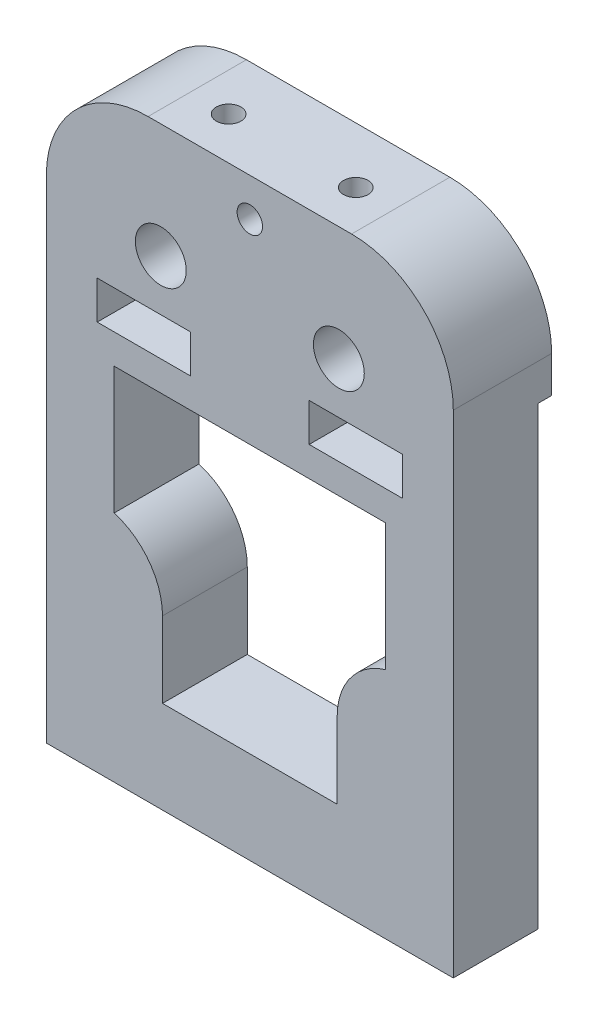
from build123d import *

# Parameters (mm, degrees)
SKETCH1_W               = 48
SKETCH1_H               = 70
BOSS_EXTRUDE1_DEPTH     = 10
SKETCH2_R               = 3
CUT_EXTRUDE1_DEPTH      = 86.463442477
SKETCH3_W               = 20.6
SKETCH3_H               = 20.6
CUT_EXTRUDE2_DEPTH      = 86.463442477
FILLET1_R               = 12
SKETCH4_R               = 1.5
CUT_EXTRUDE3_DEPTH      = 86.463442477
SKETCH5_R               = 1.45
CUT_EXTRUDE4_DEPTH      = 10
CUT_EXTRUDE5_DEPTH      = 86.463442477
CUT_EXTRUDE5_DEPTH_BACK = 86.463442477
SKETCH7_W               = 11
SKETCH7_H               = 4.5
SKETCH11_W              = 32
SKETCH11_H              = 15
CUT_EXTRUDE6_DEPTH      = 86.463442477
CUT_EXTRUDE7_DEPTH      = 8
CUT_EXTRUDE7_DEPTH_BACK = 5
SKETCH12_R              = 1.5
SKETCH13_R              = 1.5
BOSS_EXTRUDE4_DEPTH     = 1.6
FILLET2_R               = 8


with BuildPart() as part:
    # Sketch1 → Boss-Extrude1 (new body)
    with BuildSketch(Plane.XY):
        with Locations((24, -35)):
            Rectangle(SKETCH1_W, SKETCH1_H)
    extrude(amount=BOSS_EXTRUDE1_DEPTH)

    # Sketch2 → Cut-Extrude1 (cut, through all)
    with BuildSketch(Plane.XY.offset(10)):
        with Locations((13.5, -13.5)):
            Circle(SKETCH2_R)
        with Locations((34.5, -13.5)):
            Circle(SKETCH2_R)
    extrude(amount=-CUT_EXTRUDE1_DEPTH, mode=Mode.SUBTRACT)

    # Sketch3 → Cut-Extrude2 (cut, through all)
    with BuildSketch(Plane.XY.offset(10)):
        with Locations((24, -48.8)):
            Rectangle(SKETCH3_W, SKETCH3_H)
    extrude(amount=-CUT_EXTRUDE2_DEPTH, mode=Mode.SUBTRACT)

    # Fillet1
    fillet1_edges = [part.edges().sort_by_distance(p)[0] for p in [
        (0, 0, 5),
        (48, 0, 5),
    ]]
    fillet(fillet1_edges, radius=FILLET1_R)

    # Sketch4 → Cut-Extrude3 (cut, through all)
    with BuildSketch(Plane(origin=(0, 0, 0), x_dir=(-1, 0, 0), z_dir=(0, 0, -1))):
        with Locations((-24, -4.5)):
            Circle(SKETCH4_R)
    extrude(amount=-CUT_EXTRUDE3_DEPTH, mode=Mode.SUBTRACT)

    # Sketch5 → Cut-Extrude4 (cut)
    with BuildSketch(Plane(origin=(0, 0, 0), x_dir=(1, 0, 0), z_dir=(0, 1, 0))):
        with Locations(Location((16.5, -5, 0), (0, 0, 270))):
            Circle(SKETCH5_R)
        with Locations(Location((31.5, -5, 0), (0, 0, 270))):
            Circle(SKETCH5_R)
    extrude(amount=-CUT_EXTRUDE4_DEPTH, mode=Mode.SUBTRACT)

    # Sketch7 → Cut-Extrude5 (cut, two sides: drawn at the far end of the back side and taken through both)
    with BuildSketch(Plane(origin=(0, 0, 0), x_dir=(-1, 0, 0), z_dir=(0, 0, -1)).offset(-CUT_EXTRUDE5_DEPTH_BACK)):
        with Locations((-36.5, -21.75)):
            Rectangle(SKETCH7_W, SKETCH7_H)
        with Locations((-11.5, -21.75)):
            Rectangle(SKETCH7_W, SKETCH7_H)
    extrude(amount=CUT_EXTRUDE5_DEPTH + CUT_EXTRUDE5_DEPTH_BACK, mode=Mode.SUBTRACT)

    # Sketch11 → Cut-Extrude6 (cut, through all)
    with BuildSketch(Plane(origin=(0, 0, 0), x_dir=(-1, 0, 0), z_dir=(0, 0, -1))):
        with Locations((-24, -35)):
            Rectangle(SKETCH11_W, SKETCH11_H)
    extrude(amount=-CUT_EXTRUDE6_DEPTH, mode=Mode.SUBTRACT)

    # Sketch12 → Cut-Extrude7 (cut, two sides: drawn at the far end of the back side and taken through both)
    with BuildSketch(Plane(origin=(0, -24, 0), x_dir=(1, 0, 0), z_dir=(0, 1, 0)).offset(-CUT_EXTRUDE7_DEPTH_BACK)):
        with Locations(Location((36.5, -3, 0), (0, 0, 90))):
            Circle(SKETCH12_R)
        with Locations((11.5, -3)):
            Circle(SKETCH12_R)
    extrude(amount=CUT_EXTRUDE7_DEPTH + CUT_EXTRUDE7_DEPTH_BACK, mode=Mode.SUBTRACT)

    # Sketch13 → Boss-Extrude4 (add)
    with BuildSketch(Plane(origin=(0, 0, 0), x_dir=(-1, 0, 0), z_dir=(0, 0, -1))):
        with BuildLine():
            Line((-48, -12), (-48, -16.3))
            Line((-48, -16.3), (-35.577032961, -16.3))
            ThreePointArc((-35.577032961, -16.3), (-36.198367027, -11.027036304), (-31.5, -13.5))
            ThreePointArc((-31.5, -13.5), (-32.027036304, -15.198367027), (-33.422967039, -16.3))
            Line((-33.422967039, -16.3), (-14.577032961, -16.3))
            ThreePointArc((-14.577032961, -16.3), (-15.198367027, -11.027036304), (-10.5, -13.5))
            ThreePointArc((-10.5, -13.5), (-11.027036304, -15.198367027), (-12.422967039, -16.3))
            Line((-12.422967039, -16.3), (0, -16.3))
            Line((0, -16.3), (0, -12))
            ThreePointArc((0, -12), (-3.514718626, -3.514718626), (-12, 0))
            Line((-12, 0), (-36, 0))
            ThreePointArc((-36, 0), (-44.485281374, -3.514718626), (-48, -12))
        make_face()
        with Locations((-24, -4.5)):
            Circle(SKETCH13_R, mode=Mode.SUBTRACT)
    extrude(amount=BOSS_EXTRUDE4_DEPTH)

    # Fillet2
    # the kernel refuses this fillet: 8 mm, written as the material it takes off along each edge
    with BuildSketch(Plane(origin=(13.7, -42.5, -19.155612754), x_dir=(-1, 0, 0), z_dir=(0, 0, 1))) as fillet2_piece_1:
        with BuildLine():
            CenterArc((8, 7.662245102), FILLET2_R, 180, 73.291656284)
            Line((0, 7.662245102), (-0.16, 7.662245102))
            Line((-0.16, 7.662245102), (-0.16, 0))
            Line((-0.16, 0), (0, -0.16))
            ThreePointArc((0, -0.16), (2.85, -0.16), (5.654, -0.153244902))
            Line((5.654, -0.153244902), (5.7, 0))
        make_face()
    extrude(amount=48.311225509, mode=Mode.SUBTRACT)
    with BuildSketch(Plane(origin=(34.3, -42.5, 29.155612754), x_dir=(0, -1, 0), z_dir=(0, 0, -1))) as fillet2_piece_2:
        with BuildLine():
            CenterArc((7.662245102, -8), FILLET2_R, 90, 73.291656284)
            Line((0, -5.7), (-0.153244902, -5.654))
            ThreePointArc((-0.153244902, -5.654), (-0.16, -2.85), (-0.16, 0))
            Line((-0.16, 0), (0, 0.16))
            Line((0, 0.16), (7.662245102, 0.16))
            Line((7.662245102, 0.16), (7.662245102, 0))
        make_face()
    extrude(amount=48.311225509, mode=Mode.SUBTRACT)


solid = part.part
